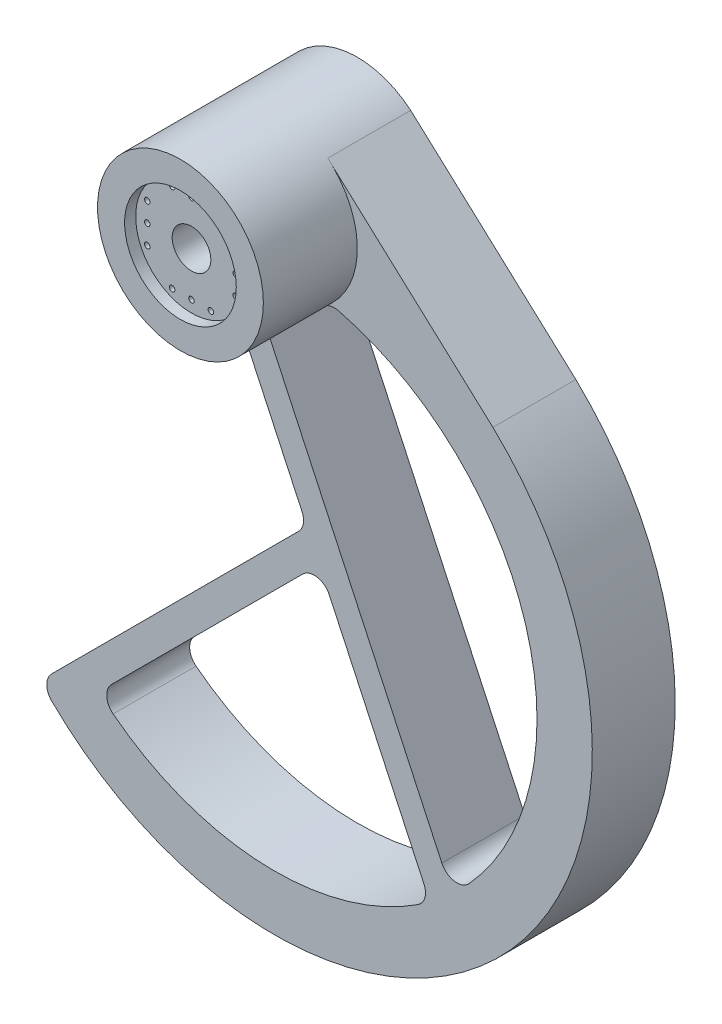
from build123d import *

# Parameters (mm, degrees)
EXTRUDE_1_DEPTH     = 15
SKETCH_6_R          = 3.5
CUT_EXTRUDE_2_DEPTH = 15
SKETCH_9_R          = 15
SKETCH_9_R_2        = 3.5
EXTRUDE_2_DEPTH     = 17
SKETCH_10_R         = 10.1
CUT_EXTRUDE_5_DEPTH = 2
SKETCH_11_R         = 0.5
CUT_EXTRUDE_6_DEPTH = 3


with BuildPart() as part:
    # ｽｹｯﾁ1 → ﾎﾞｽ - 押し出し1 (new body)
    with BuildSketch(Plane.XY):
        with BuildLine():
            Line((10.546944731, 68.165925034), (9.641814145, 68.990666647))
            ThreePointArc((9.641814145, 68.990666647), (-9.131421435, 69.400300104), (-13.594616806, 51.160726074))
            Line((-13.594616806, 51.160726074), (4.986432096, 11.313538113))
            ThreePointArc((4.986432096, 11.313538113), (5.221931994, 9.524738795), (4.388829079, 7.924362985))
            Line((4.388829079, 7.924362985), (-40.303464689, -36.767930783))
            ThreePointArc((-40.303464689, -36.767930783), (-41.182112782, -38.903012739), (-40.283913759, -41.029943849))
            ThreePointArc((-40.283913759, -41.029943849), (41.397896806, -39.905690573), (39.524106652, 41.762363359))
            Line((39.524106652, 41.762363359), (37.916838192, 43.226882625))
            Line((37.916838192, 43.226882625), (10.546944731, 68.165925034))
        make_face()
        with BuildLine():
            ThreePointArc((5.093338956, 1.55780505), (7.735603832, 2.390907965), (9.933582661, 0.704339492))
            Line((9.933582661, 0.704339492), (27.046217634, -35.993824637))
            ThreePointArc((27.046217634, -35.993824637), (27.212084573, -38.085077821), (25.967336583, -39.773702754))
            ThreePointArc((25.967336583, -39.773702754), (-1.972837213, -47.459012983), (-29.17877254, -37.481318454))
            ThreePointArc((-29.17877254, -37.481318454), (-30.330146685, -35.299826939), (-29.457223039, -32.992756945))
            Line((-29.457223039, -32.992756945), (5.093338956, 1.55780505))
        make_face(mode=Mode.SUBTRACT)
        with BuildLine():
            ThreePointArc((35.231836325, -31.858557864), (32.560090836, -32.813013733), (30.287744354, -31.114293205))
            Line((30.287744354, -31.114293205), (-2.054746852, 38.244403012))
            ThreePointArc((-2.054746852, 38.244403012), (-1.895310582, 41.077194163), (0.553480425, 42.510214831))
            ThreePointArc((0.553480425, 42.510214831), (5.039223996, 43.371793408), (9.057681155, 45.543478261))
            ThreePointArc((9.057681155, 45.543478261), (10.270904088, 46.091905397), (11.601973614, 46.061309233))
            ThreePointArc((11.601973614, 46.061309233), (45.455779175, 13.784851815), (35.231836325, -31.858557864))
        make_face(mode=Mode.SUBTRACT)
    extrude(amount=EXTRUDE_1_DEPTH)

    # ｽｹｯﾁ6 → ｶｯﾄ - 押し出し2 (cut)
    with BuildSketch(Plane.XY.offset(15)):
        with Locations((0, 57.5)):
            Circle(SKETCH_6_R)
    extrude(amount=-CUT_EXTRUDE_2_DEPTH, mode=Mode.SUBTRACT)

    # ｽｹｯﾁ9 → ﾎﾞｽ - 押し出し2 (add)
    with BuildSketch(Plane.XY.offset(15)):
        with Locations((0, 57.5)):
            Circle(SKETCH_9_R)
        with Locations((0, 57.5)):
            Circle(SKETCH_9_R_2, mode=Mode.SUBTRACT)
    extrude(amount=EXTRUDE_2_DEPTH)

    # ｽｹｯﾁ10 → ｶｯﾄ - 押し出し5 (cut)
    with BuildSketch(Plane.XY.offset(32)):
        with Locations((0, 57.5)):
            Circle(SKETCH_10_R)
    extrude(amount=-CUT_EXTRUDE_5_DEPTH, mode=Mode.SUBTRACT)

    # ｽｹｯﾁ11 → ｶｯﾄ - 押し出し6 (cut)
    with BuildSketch(Plane.XY.offset(30)):
        with Locations((-3.5, 65.5)):
            Circle(SKETCH_11_R)
        with Locations((0, 65.5)):
            Circle(SKETCH_11_R)
        with Locations((3.5, 65.5)):
            Circle(SKETCH_11_R)
        with Locations((8, 57.5)):
            Circle(SKETCH_11_R)
        with Locations((8, 61)):
            Circle(SKETCH_11_R)
        with Locations((8, 54)):
            Circle(SKETCH_11_R)
        with Locations((0, 49.5)):
            Circle(SKETCH_11_R)
        with Locations((3.5, 49.5)):
            Circle(SKETCH_11_R)
        with Locations((-3.5, 49.5)):
            Circle(SKETCH_11_R)
        with Locations((-8, 57.5)):
            Circle(SKETCH_11_R)
        with Locations((-8, 54)):
            Circle(SKETCH_11_R)
        with Locations((-8, 61)):
            Circle(SKETCH_11_R)
    extrude(amount=-CUT_EXTRUDE_6_DEPTH, mode=Mode.SUBTRACT)


solid = part.part
